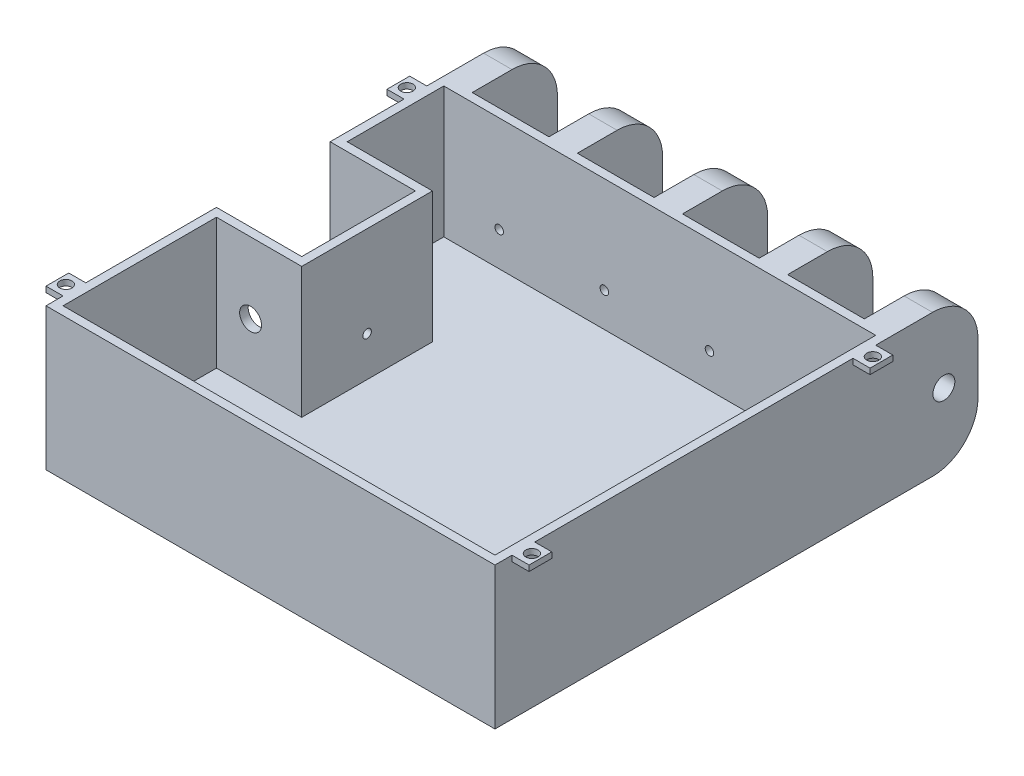
from build123d import *

# Parameters (mm, degrees)
BOSS_EXTRUDE1_DEPTH     = 25
CUT_EXTRUDE2_DEPTH      = 23
FILLET1_R               = 8
SKETCH10_R              = 0.75
CUT_EXTRUDE4_DEPTH      = 2
LPATTERN2_COUNT         = 2
LPATTERN2_PITCH         = 2
LPATTERN2_COUNT_DIR2    = 4
LPATTERN2_PITCH_DIR2    = 18.5
SKETCH11_R              = 0.75
CUT_EXTRUDE5_DEPTH      = 2
SKETCH13_W              = 4
SKETCH13_H              = 1
BOSS_EXTRUDE4_DEPTH     = 3
SKETCH14_R              = 1.078343224
CUT_EXTRUDE6_DEPTH      = 121.519707932
LPATTERN3_COUNT         = 2
LPATTERN3_PITCH         = 60
LPATTERN3_COUNT_DIR2    = 2
LPATTERN3_PITCH_DIR2    = 82
LPATTERN4_COUNT         = 2
LPATTERN4_PITCH         = 60
LPATTERN4_COUNT_DIR2    = 2
LPATTERN4_PITCH_DIR2    = 82
CUT_EXTRUDE7_DEPTH      = 118.383985279
CUT_EXTRUDE7_DEPTH_BACK = 19
SKETCH3_R               = 1.925
CUT_EXTRUDE8_DEPTH      = 25
CUT_EXTRUDE8_DEPTH_BACK = 5
SKETCH9_R               = 1.925


with BuildPart() as part:
    # Sketch2 → Boss-Extrude1 (new body)
    with BuildSketch(Plane(origin=(0, 0, 0), x_dir=(1, 0, 0), z_dir=(0, 1, 0))):
        Polygon((0, 0), (79, 0), (79, 85), (74, 85), (74, 70), (60.5, 70), (60.5, 85), (55.5, 85), (55.5, 70), (42, 70), (42, 85), (37, 85), (37, 70), (23.5, 70), (23.5, 85), (18.5, 85), (18.5, 70), (5, 70), (5, 85), (0, 85), (0, 50), (15, 50), (15, 30), (0, 30), align=None)
    extrude(amount=BOSS_EXTRUDE1_DEPTH)

    # Sketch4 → Cut-Extrude2 (cut)
    with BuildSketch(Plane(origin=(0, 25, 0), x_dir=(1, 0, 0), z_dir=(0, 1, 0))):
        Polygon((1.5, 68.5), (1.5, 51.5), (16.5, 51.5), (16.5, 28.5), (1.5, 28.5), (1.5, 1.5), (77.5, 1.5), (77.5, 68.5), align=None)
    extrude(amount=-CUT_EXTRUDE2_DEPTH, mode=Mode.SUBTRACT)

    # Fillet1
    fillet1_edges = [part.edges().sort_by_distance(p)[0] for p in [
        (2.5, 0, -85),
        (21, 0, -85),
        (39.5, 0, -85),
        (58, 0, -85),
        (76.5, 0, -85),
        (76.5, 25, -85),
        (58, 25, -85),
        (39.5, 25, -85),
        (21, 25, -85),
        (2.5, 25, -85),
    ]]
    fillet(fillet1_edges, radius=FILLET1_R)

    # Sketch10 → Cut-Extrude4 (cut)
    with BuildSketch(Plane.XY.offset(-68.5)):
        with Locations((11.25, 8)):
            Circle(SKETCH10_R)
    cut_extrude4 = extrude(amount=-CUT_EXTRUDE4_DEPTH, mode=Mode.SUBTRACT)

    # LPattern2: Cut-Extrude4 2 × 4
    with Locations(*[(j * LPATTERN2_PITCH_DIR2, 0, -i * LPATTERN2_PITCH) for i in range(LPATTERN2_COUNT) for j in range(LPATTERN2_COUNT_DIR2) if (i, j) != (0, 0)]):
        add(cut_extrude4, mode=Mode.SUBTRACT)

    # Sketch11 → Cut-Extrude5 (cut)
    with BuildSketch(Plane(origin=(16.5, 0, 0), x_dir=(0, 0, -1), z_dir=(1, 0, 0))):
        with Locations((40, 9)):
            Circle(SKETCH11_R)
    extrude(amount=-CUT_EXTRUDE5_DEPTH, mode=Mode.SUBTRACT)

    # Sketch13 → Boss-Extrude4 (add)
    with BuildSketch(Plane(origin=(79, 0, 0), x_dir=(0, 0, -1), z_dir=(1, 0, 0))):
        with Locations((5, 24.5)):
            Rectangle(SKETCH13_W, SKETCH13_H)
    boss_extrude4 = extrude(amount=BOSS_EXTRUDE4_DEPTH)

    # Sketch14 → Cut-Extrude6 (cut, through all)
    with BuildSketch(Plane(origin=(0, 24, 0), x_dir=(-1, 0, 0), z_dir=(0, -1, 0))):
        with Locations((-80.5, 5)):
            Circle(SKETCH14_R)
    cut_extrude6 = extrude(amount=-CUT_EXTRUDE6_DEPTH, mode=Mode.SUBTRACT)

    # LPattern3: Boss-Extrude4 2 × 2
    with Locations(*[(-j * LPATTERN3_PITCH_DIR2, 0, -i * LPATTERN3_PITCH) for i in range(LPATTERN3_COUNT) for j in range(LPATTERN3_COUNT_DIR2) if (i, j) != (0, 0)]):
        add(boss_extrude4)

    # LPattern4: Cut-Extrude6 2 × 2
    with Locations(*[(-j * LPATTERN4_PITCH_DIR2, 0, -i * LPATTERN4_PITCH) for i in range(LPATTERN4_COUNT) for j in range(LPATTERN4_COUNT_DIR2) if (i, j) != (0, 0)]):
        add(cut_extrude6, mode=Mode.SUBTRACT)

    # Sketch3 → Cut-Extrude7 (cut, two sides: drawn at the far end of the back side and taken through both)
    with BuildSketch(Plane.ZY.offset(-74).offset(-CUT_EXTRUDE7_DEPTH_BACK)):
        with Locations((-79, 12.5)):
            Circle(SKETCH3_R)
    extrude(amount=CUT_EXTRUDE7_DEPTH + CUT_EXTRUDE7_DEPTH_BACK, mode=Mode.SUBTRACT)

    # Sketch9 → Cut-Extrude8 (cut, two sides: drawn at the far end of the back side and taken through both)
    with BuildSketch(Plane.XY.offset(-50).offset(-CUT_EXTRUDE8_DEPTH_BACK)):
        with Locations((7.5, 12.5)):
            Circle(SKETCH9_R)
    extrude(amount=CUT_EXTRUDE8_DEPTH + CUT_EXTRUDE8_DEPTH_BACK, mode=Mode.SUBTRACT)


solid = part.part
